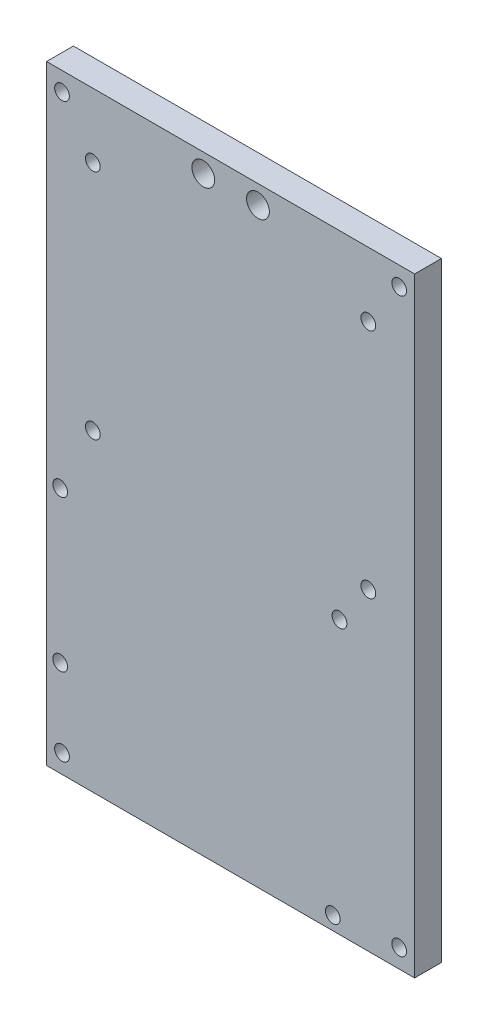
from build123d import *

# Parameters (mm, degrees)
SKETCH1_W                        = 68.600000001
SKETCH1_H                        = 113.65
BRACKETBASE_DEPTH                = 5
ARDUINOMOUNTINGHOLES_DEPTH       = 22
ARDUINOMOUNTINGHOLES_DEPTH_BACK  = 120.777809299
ARDUINOMOUNTINGHOLESSKETCH_R     = 1.375
F_9VBATTERYMOUNTINGHOLESSKETCH_R = 1.375
F_9VBATTERYMOUNTINGHOLES_DEPTH   = 20
LEGBRACKETMOUNTINGHOLESSKETCH_R  = 2.125
LEGBRACKETMOUNTINGHOLES_DEPTH    = 13
BACKSIDEMOUNTINGHOLESSKETCH_R    = 1.375
BACKSIDEMOUNTINGHOLES_DEPTH      = 24


with BuildPart() as part:
    # Sketch1 → bracketBase (new body)
    with BuildSketch(Plane.XY):
        with Locations((34.3, 41.235000001)):
            Rectangle(SKETCH1_W, SKETCH1_H)
    extrude(amount=BRACKETBASE_DEPTH)

    # arduinoMountingHolesSketch → arduinoMountingHoles (cut, two sides: drawn at the far end of the back side and taken through both)
    with BuildSketch(Plane.XY.offset(-ARDUINOMOUNTINGHOLES_DEPTH_BACK)):
        with Locations((2.54, 2.280000001)):
            Circle(ARDUINOMOUNTINGHOLESSKETCH_R)
        with Locations((2.54, 30.450000001)):
            Circle(ARDUINOMOUNTINGHOLESSKETCH_R)
        with Locations((54.600000001, 35.270000001)):
            Circle(ARDUINOMOUNTINGHOLESSKETCH_R)
        with Locations((53.350000001, -13.049999999)):
            Circle(ARDUINOMOUNTINGHOLESSKETCH_R)
    extrude(amount=ARDUINOMOUNTINGHOLES_DEPTH + ARDUINOMOUNTINGHOLES_DEPTH_BACK, mode=Mode.SUBTRACT)

    # 9VbatteryMountingHolesSketch → 9VbatteryMountingHoles (cut)
    with BuildSketch(Plane.XY):
        with Locations((8.625000001, 86.060000001)):
            Circle(F_9VBATTERYMOUNTINGHOLESSKETCH_R)
        with Locations((59.975000001, 86.060000001)):
            Circle(F_9VBATTERYMOUNTINGHOLESSKETCH_R)
        with Locations((8.625000001, 42.810000001)):
            Circle(F_9VBATTERYMOUNTINGHOLESSKETCH_R)
        with Locations((59.975000001, 42.810000001)):
            Circle(F_9VBATTERYMOUNTINGHOLESSKETCH_R)
    extrude(amount=F_9VBATTERYMOUNTINGHOLES_DEPTH, mode=Mode.SUBTRACT)

    # legBracketMountingHolesSketch → legBracketMountingHoles (cut)
    with BuildSketch(Plane.XY):
        with Locations((29.202551646, 94.560000001)):
            Circle(LEGBRACKETMOUNTINGHOLESSKETCH_R)
        with Locations((39.397448356, 94.560000001)):
            Circle(LEGBRACKETMOUNTINGHOLESSKETCH_R)
    extrude(amount=LEGBRACKETMOUNTINGHOLES_DEPTH, mode=Mode.SUBTRACT)

    # backsideMountingHolesSketch → backsideMountingHoles (cut)
    with BuildSketch(Plane.XY):
        with Locations((2.875000001, 94.560000001)):
            Circle(BACKSIDEMOUNTINGHOLESSKETCH_R)
        with Locations((65.725000001, 94.560000001)):
            Circle(BACKSIDEMOUNTINGHOLESSKETCH_R)
        with Locations((65.725000001, -12.089999999)):
            Circle(BACKSIDEMOUNTINGHOLESSKETCH_R)
        with Locations((2.875000001, -12.089999999)):
            Circle(BACKSIDEMOUNTINGHOLESSKETCH_R)
    extrude(amount=BACKSIDEMOUNTINGHOLES_DEPTH, mode=Mode.SUBTRACT)


solid = part.part
